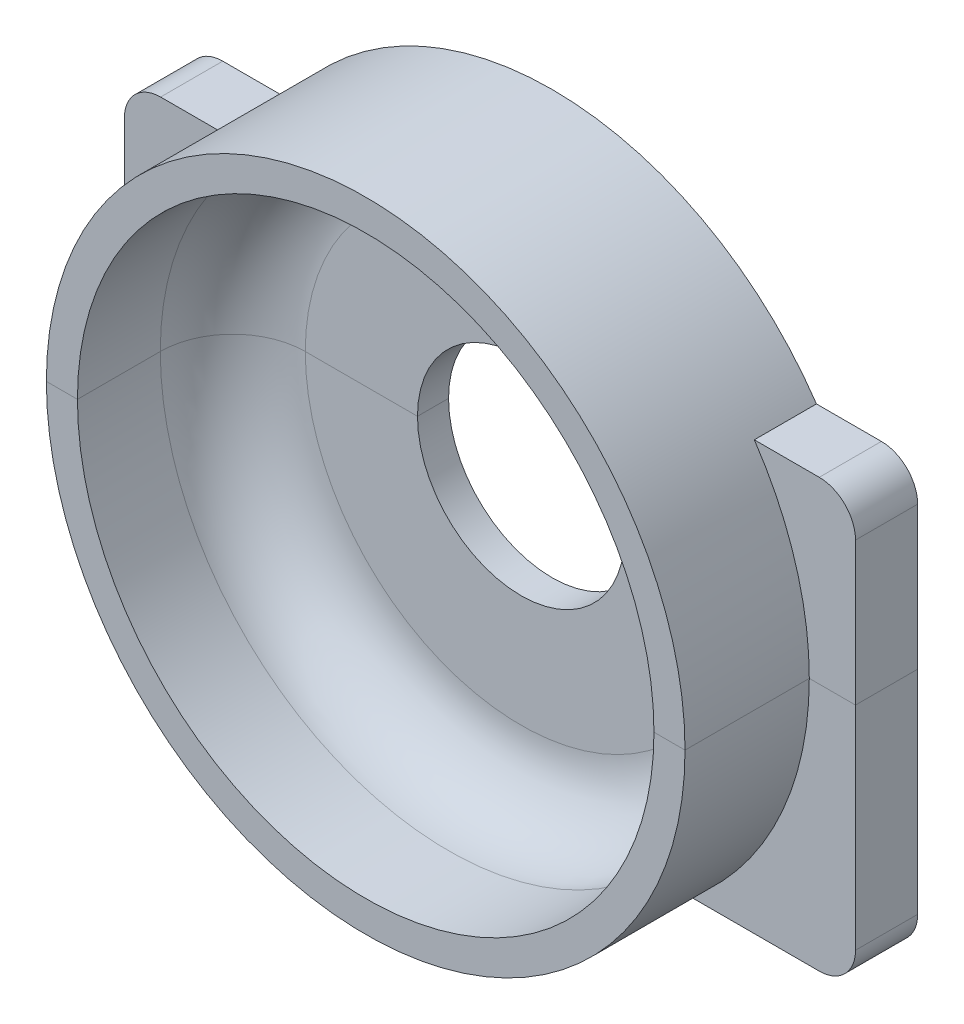
from build123d import *

# Parameters (mm, degrees)
SKETCH2_R           = 10
BOSS_EXTRUDE1_DEPTH = 3
SKETCH3_R           = 30.836001618
SKETCH3_R_2         = 27.836001618
BOSS_EXTRUDE2_DEPTH = 15
FILLET1_R           = 7
BOSS_EXTRUDE4_DEPTH = 3
SKETCH6_R           = 2.38125
CUT_EXTRUDE1_DEPTH  = 3.175


with BuildPart() as part:
    # Sketch2 → Boss-Extrude1 (new body)
    with BuildSketch(Plane.XY):
        with BuildLine():
            ThreePointArc((-63.558014619, 3.369158846), (-62.532888353, 0.894285111), (-60.058014619, -0.130841154))
            Line((-60.058014619, -0.130841154), (-47.613328162, -0.130841154))
            ThreePointArc((-47.613328162, -0.130841154), (-28.255353364, -6.964180264), (-8.897378566, -0.130841154))
            Line((-8.897378566, -0.130841154), (3.541985381, -0.130841154))
            ThreePointArc((3.541985381, -0.130841154), (6.016859115, 0.894285111), (7.041985381, 3.369158846))
            Line((7.041985381, 3.369158846), (7.041985381, 37.669158846))
            ThreePointArc((7.041985381, 37.669158846), (6.016859115, 40.14403258), (3.541985381, 41.169158846))
            Line((3.541985381, 41.169158846), (-2.727699507, 41.169158846))
            ThreePointArc((-2.727699507, 41.169158846), (-28.255353364, 54.707822971), (-53.783007221, 41.169158846))
            Line((-53.783007221, 41.169158846), (-60.058014619, 41.169158846))
            ThreePointArc((-60.058014619, 41.169158846), (-62.532888353, 40.14403258), (-63.558014619, 37.669158846))
            Line((-63.558014619, 37.669158846), (-63.558014619, 3.369158846))
        make_face()
        with Locations((-28.255353364, 23.871821354)):
            Circle(SKETCH2_R, mode=Mode.SUBTRACT)
    extrude(amount=BOSS_EXTRUDE1_DEPTH)

    # Sketch3 → Boss-Extrude2 (add)
    with BuildSketch(Plane.XY.offset(3)):
        with Locations((-28.255353364, 23.871821354)):
            Circle(SKETCH3_R)
        with Locations((-28.255353364, 23.871821354)):
            Circle(SKETCH3_R_2, mode=Mode.SUBTRACT)
    extrude(amount=BOSS_EXTRUDE2_DEPTH)

    # Fillet1
    fillet1_edges = [part.edges().sort_by_distance(p)[0] for p in [
        (-56.091354982, 23.871821354, 3),
    ]]
    fillet(fillet1_edges, radius=FILLET1_R)

    # Sketch7 → Boss-Extrude4 (add)
    with BuildSketch(Plane.XY.offset(3)):
        with BuildLine():
            Line((-8.897378566, -0.130841154), (3.541985381, -0.130841154))
            ThreePointArc((3.541985381, -0.130841154), (6.016859115, 0.894285111), (7.041985381, 3.369158846))
            Line((7.041985381, 3.369158846), (7.041985381, 37.669158846))
            ThreePointArc((7.041985381, 37.669158846), (6.016859115, 40.14403258), (3.541985381, 41.169158846))
            Line((3.541985381, 41.169158846), (-2.727699507, 41.169158846))
            ThreePointArc((-2.727699507, 41.169158846), (2.242227113, 19.315882283), (-8.897378566, -0.130841154))
        make_face()
        with BuildLine():
            Line((-53.783007221, 41.169158846), (-60.058014619, 41.169158846))
            ThreePointArc((-60.058014619, 41.169158846), (-62.532888353, 40.14403258), (-63.558014619, 37.669158846))
            Line((-63.558014619, 37.669158846), (-63.558014619, 3.369158846))
            ThreePointArc((-63.558014619, 3.369158846), (-62.532888353, 0.894285111), (-60.058014619, -0.130841154))
            Line((-60.058014619, -0.130841154), (-47.613328162, -0.130841154))
            ThreePointArc((-47.613328162, -0.130841154), (-58.752933841, 19.315882283), (-53.783007221, 41.169158846))
        make_face()
    extrude(amount=BOSS_EXTRUDE4_DEPTH)

    # Sketch6 → Cut-Extrude1 (cut)
    with BuildSketch(Plane(origin=(0, 0, 0), x_dir=(-1, 0, 0), z_dir=(0, 0, -1))):
        with Locations((58.558014619, 4.869158846)):
            Circle(SKETCH6_R)
        with Locations((58.558014619, 33.869158846)):
            Circle(SKETCH6_R)
        with Locations((-2.041985381, 33.869158846)):
            Circle(SKETCH6_R)
        with Locations((-2.041985381, 4.869158846)):
            Circle(SKETCH6_R)
    extrude(amount=-CUT_EXTRUDE1_DEPTH, mode=Mode.SUBTRACT)


with BuildPart() as body_2:
    # Split1: the piece on the far side of the plane
    add(part.part)
    split(bisect_by=Plane.ZX.offset(23.871821354), keep=Keep.BOTTOM)


with BuildPart() as part_1:
    add(part.part)

    # Split1
    split(bisect_by=Plane.ZX.offset(23.871821354), keep=Keep.TOP)


solid = Compound([body_2.part, part_1.part])
